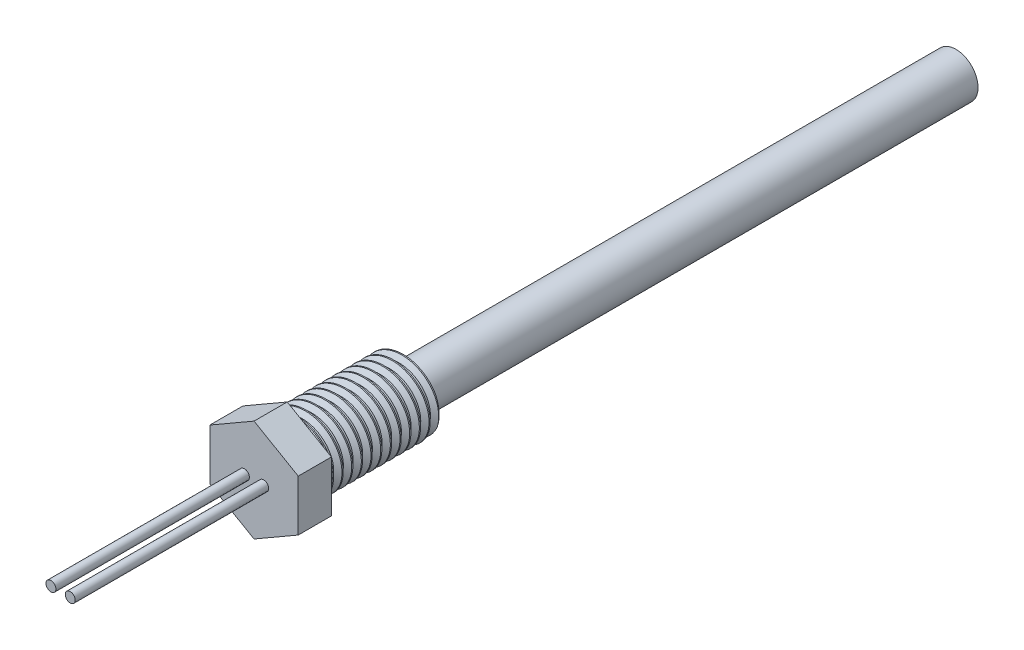
from build123d import *

# Parameters (mm, degrees)
IZIM1_R                     = 4
Y_KSEKLIK_EKSTR_ZYON1_DEPTH = 150
IZIM2_R                     = 6.5
Y_KSEKLIK_EKSTR_ZYON2_DEPTH = 27
DI_1_PITCH                  = 1.75
IZIM3_R                     = 13.025335345
KES_EKSTR_ZYON1_DEPTH       = 50
Y_KSEKLIK_EKSTR_ZYON4_DEPTH = 6
IZIM6_R                     = 0.9
Y_KSEKLIK_EKSTR_ZYON5_DEPTH = 35


with BuildPart() as part:
    # Çizim1 → Yükseklik-Ekstrüzyon1 (new body)
    with BuildSketch(Plane.XY):
        Circle(IZIM1_R)
    extrude(amount=Y_KSEKLIK_EKSTR_ZYON1_DEPTH)

    # Çizim2 → Yükseklik-Ekstrüzyon2 (add)
    with BuildSketch(Plane.XY.offset(150)):
        Circle(IZIM2_R)
    extrude(amount=Y_KSEKLIK_EKSTR_ZYON2_DEPTH)

    # Diş1: the profile of Diş Profili1 profile screwed along a right-hand helix of 17.142857 turns, 10 arcs to a turn; built about Z, then put on its axis
    di_1_z = Axis((0, 0, 0), (0, 0, 1))
    di_1_corners = [(6.5003, 0, -0.000173205), (6.5003, 0, 1.5314232), (5.552784719, 0, 0.984374998), (5.552784719, 0, 0.546874998)]
    with BuildLine(mode=Mode.PRIVATE) as di_1_profile:
        Line(di_1_corners[0], di_1_corners[1])
        Line(di_1_corners[1], di_1_corners[2])
        Line(di_1_corners[2], di_1_corners[3])
        Line(di_1_corners[3], di_1_corners[0])
    di_1_cap = Face(di_1_profile.wire())
    di_1_turn_angles = [0, 18, 36, 54, 72, 90, 108, 126, 144, 162, 180, 198, 216, 234, 252, 270, 288, 306, 324, 342, 360]
    di_1_turn_weights = [1, 0.9510565162951535, 1, 0.9510565162951535, 1, 0.9510565162951535, 1, 0.9510565162951535, 1, 0.9510565162951535, 1, 0.9510565162951535, 1, 0.9510565162951535, 1, 0.9510565162951535, 1, 0.9510565162951535, 1, 0.9510565162951535, 1]
    di_1_turn_rails = [Edge.make_bspline([Vector(p[0], p[1], 0).rotate(di_1_z, di_1_turn_angles[k]) / di_1_turn_weights[k] + Vector(0, 0, p[2] + DI_1_PITCH * di_1_turn_angles[k] / 360) for k in range(21)], [0, 0, 0, 1, 1, 2, 2, 3, 3, 4, 4, 5, 5, 6, 6, 7, 7, 8, 8, 9, 9, 10, 10, 10], 2, di_1_turn_weights) for p in di_1_corners]
    di_1_turn_sides = [Face.make_surface_from_curves(di_1_turn_rails[p[0]], di_1_turn_rails[p[1]]) for p in [(0, 1), (1, 2), (2, 3), (3, 0)]]
    di_1_last_angles = [6120, 6138, 6156, 6163.714285714, 6171.428571429]
    di_1_last_weights = [1, 0.9510565162951535, 1, 0.9909497617679346, 1]
    di_1_last_rails = [Edge.make_bspline([Vector(p[0], p[1], 0).rotate(di_1_z, di_1_last_angles[k]) / di_1_last_weights[k] + Vector(0, 0, p[2] + DI_1_PITCH * di_1_last_angles[k] / 360) for k in range(5)], [0, 0, 0, 1, 1, 2, 2, 2], 2, di_1_last_weights) for p in di_1_corners]
    di_1_last_sides = [Face.make_surface_from_curves(di_1_last_rails[p[0]], di_1_last_rails[p[1]]) for p in [(0, 1), (1, 2), (2, 3), (3, 0)]]
    di_1 = Plane(origin=(0, 0, 177), x_dir=(-1, 0, 0), z_dir=(0, 0, -1)) * Solid(Shell([*[p.moved(Location((0, 0, DI_1_PITCH * i))) for i in range(17) for p in di_1_turn_sides], *di_1_last_sides, di_1_cap, di_1_cap.rotate(di_1_z, 6171.428571429).moved(Location((0, 0, DI_1_PITCH * 6171.428571429 / 360)))]))
    add(di_1, mode=Mode.SUBTRACT)

    # Çizim3 → Kes-Ekstrüzyon1 (cut)
    with BuildSketch(Plane(origin=(0, 0, 0), x_dir=(-1, 0, 0), z_dir=(0, 0, -1))):
        Circle(IZIM3_R)
    extrude(amount=-KES_EKSTR_ZYON1_DEPTH, mode=Mode.SUBTRACT)

    # Çizim5 → Yükseklik-Ekstrüzyon4 (add)
    with BuildSketch(Plane.XY.offset(177)):
        Polygon((0, -9.237604307), (8, -4.618802154), (8, 4.618802154), (0, 9.237604307), (-8, 4.618802154), (-8, -4.618802154), align=None)
    extrude(amount=-Y_KSEKLIK_EKSTR_ZYON4_DEPTH)

    # Çizim6 → Yükseklik-Ekstrüzyon5 (add)
    with BuildSketch(Plane.XY.offset(177)):
        with Locations((-1.742962513, 0)):
            Circle(IZIM6_R)
        with Locations((1.742962513, 0)):
            Circle(IZIM6_R)
    extrude(amount=Y_KSEKLIK_EKSTR_ZYON5_DEPTH)


solid = part.part
